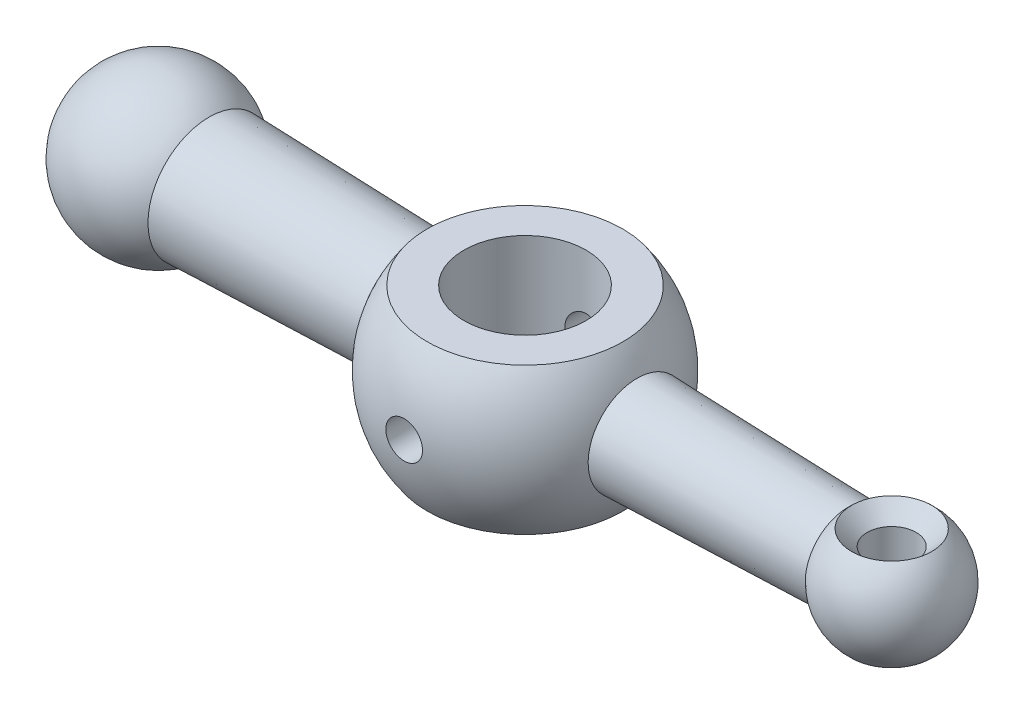
from build123d import *

# Parameters (mm, degrees)
CHAMFER_1_SIZE      = 3
SKETCH_3_R          = 3
CUT_EXTRUDE_1_DEPTH = 50


with BuildPart() as part:
    # Эскиз1 → Повернуть1 (revolve)
    with BuildSketch(Plane.XY):
        with BuildLine():
            Line((-51.693376137, 10), (-17.843804593, 9.033196425))
            ThreePointArc((-17.843804593, 9.033196425), (0.571002482, 19.991847242), (18.33030278, 8))
            Line((18.33030278, 8), (52.871765135, 7.013434801))
            ThreePointArc((52.871765135, 7.013434801), (63.789304115, 9.254251689), (70, 0))
            Line((70, 0), (-73, 0))
            ThreePointArc((-73, 0), (-65.523309234, 11.768307232), (-51.693376137, 10))
        make_face()
    revolve(axis=Axis((-73, 0, 0), (1, 0, 0)))

    # Эскиз2 → Вырез-Повернуть1 (revolve, cut)
    with BuildSketch(Plane.XY, mode=Mode.PRIVATE) as cut_revolve_1_sk:
        with BuildLine():
            Line((0, -12), (0, 12))
            Line((0, 12), (0, 20))
            ThreePointArc((0, 20), (8.94427191, 17.88854382), (16, 12))
            Line((16, 12), (10, 12))
            Line((10, 12), (10, -12))
            Line((10, -12), (16, -12))
            ThreePointArc((16, -12), (8.94427191, -17.88854382), (0, -20))
            Line((0, -20), (0, -12))
        make_face()
    revolve(cut_revolve_1_sk.sketch.rotate(Axis((0, 0, 0), (0, 1, 0)), 90), axis=Axis((0, 0, 0), (0, 1, 0)), mode=Mode.SUBTRACT)

    # Эскиз2<3> → Вырез-Повернуть2 (revolve, cut)
    with BuildSketch(Plane.XY):
        Polygon((66, -8), (66, -15.272316645), (60, -15.272316645), (60, 15.272316645), (66, 15.272316645), (66, 8), (64, 8), (64, -8), align=None)
    revolve(axis=Axis((60, -15.272316645, 0), (0, 1, 0)), mode=Mode.SUBTRACT)

    # Фаска1
    # the kernel refuses this chamfer: 3 mm, written as the material it takes off along each edge
    with BuildSketch(Plane(origin=(60, -8, 0), x_dir=(1, 0, 0), z_dir=(0, 0, 1))) as chamfer_1_piece_1:
        Polygon((4 + CHAMFER_1_SIZE, 0), (4, CHAMFER_1_SIZE), (4, 0), align=None)
    revolve(axis=Axis((60, -8, 0), (0, 1, 0)), mode=Mode.SUBTRACT)
    with BuildSketch(Plane(origin=(60, 8, 0), x_dir=(1, 0, 0), z_dir=(0, 0, 1))) as chamfer_1_piece_2:
        Polygon((4 + CHAMFER_1_SIZE, 0), (4, -CHAMFER_1_SIZE), (4, 0), align=None)
    revolve(axis=Axis((60, 8, 0), (0, 1, 0)), mode=Mode.SUBTRACT)

    # Эскиз3 → Вырез-Вытянуть1 (cut, symmetric)
    with BuildSketch(Plane.XY):
        Circle(SKETCH_3_R)
    extrude(amount=CUT_EXTRUDE_1_DEPTH, both=True, mode=Mode.SUBTRACT)


solid = part.part
